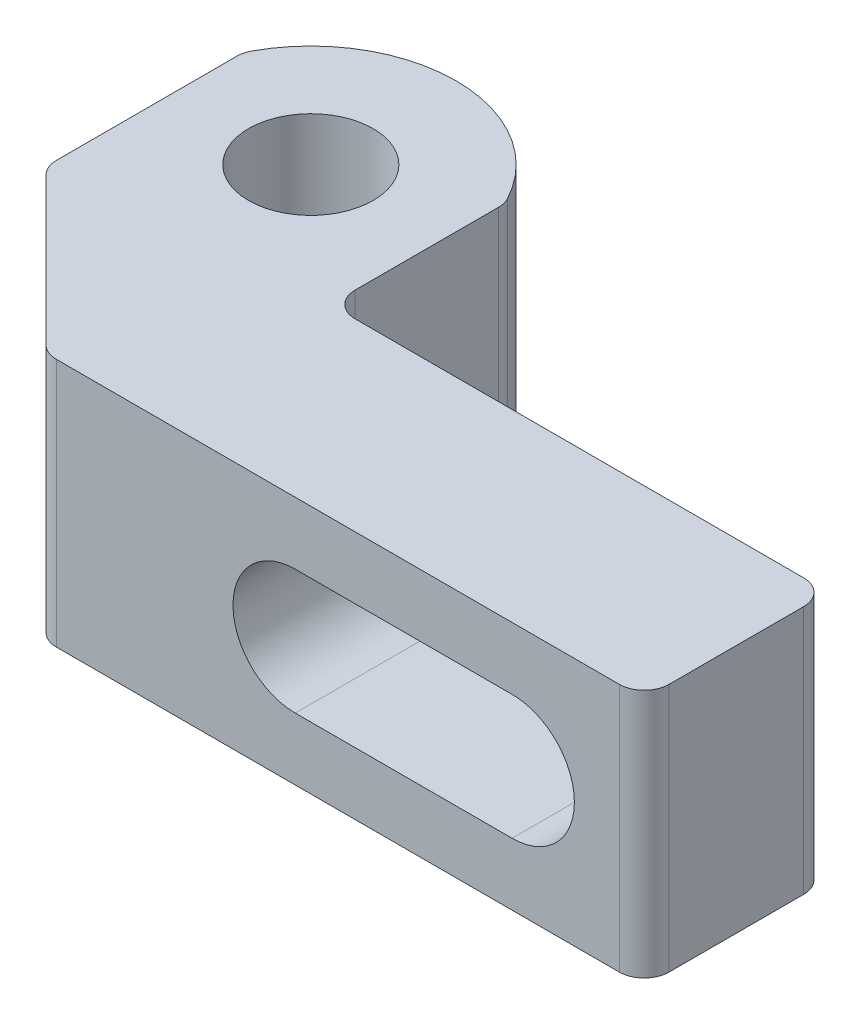
from build123d import *

# Parameters (mm, degrees)
SKETCH1_R           = 2.5
BOSS_EXTRUDE1_DEPTH = 10
CUT_EXTRUDE1_DEPTH  = 34.709642537
FILLET2_R           = 1


with BuildPart() as part:
    # Sketch1 → Boss-Extrude1 (new body)
    with BuildSketch(Plane(origin=(0, 0, 0), x_dir=(1, 0, 0), z_dir=(0, 1, 0))):
        with BuildLine():
            Line((0, 0), (0, 7.4))
            Line((0, 7.4), (-20, 7.4))
            Line((-20, 7.4), (-20, 14.4))
            ThreePointArc((-20, 14.4), (-25.25, 17.7), (-30.5, 14.4))
            Line((-30.5, 14.4), (-30.5, 6.5))
            Line((-30.5, 6.5), (-24, 0))
            Line((-24, 0), (0, 0))
        make_face()
        with Locations((-25.25, 11.873863636)):
            Circle(SKETCH1_R, mode=Mode.SUBTRACT)
    extrude(amount=BOSS_EXTRUDE1_DEPTH)

    # Sketch3 → Cut-Extrude1 (cut, through all)
    with BuildSketch(Plane(origin=(0, 0, -7.4), x_dir=(-1, 0, 0), z_dir=(0, 0, -1))):
        with BuildLine():
            Line((14, 2.5), (5.3, 2.5))
            ThreePointArc((5.3, 2.5), (2.8, 5), (5.3, 7.5))
            Line((5.3, 7.5), (14, 7.5))
            ThreePointArc((14, 7.5), (16.5, 5), (14, 2.5))
        make_face()
    extrude(amount=-CUT_EXTRUDE1_DEPTH, mode=Mode.SUBTRACT)

    # Fillet2
    fillet2_edges = [part.edges().sort_by_distance(p)[0] for p in [
        (-24, 5, 0),
        (-30.5, 5, -6.5),
        (-30.5, 5, -14.4),
        (-20, 5, -14.4),
        (-20, 5, -7.4),
        (0, 5, -7.4),
        (0, 5, 0),
    ]]
    fillet(fillet2_edges, radius=FILLET2_R)


solid = part.part
